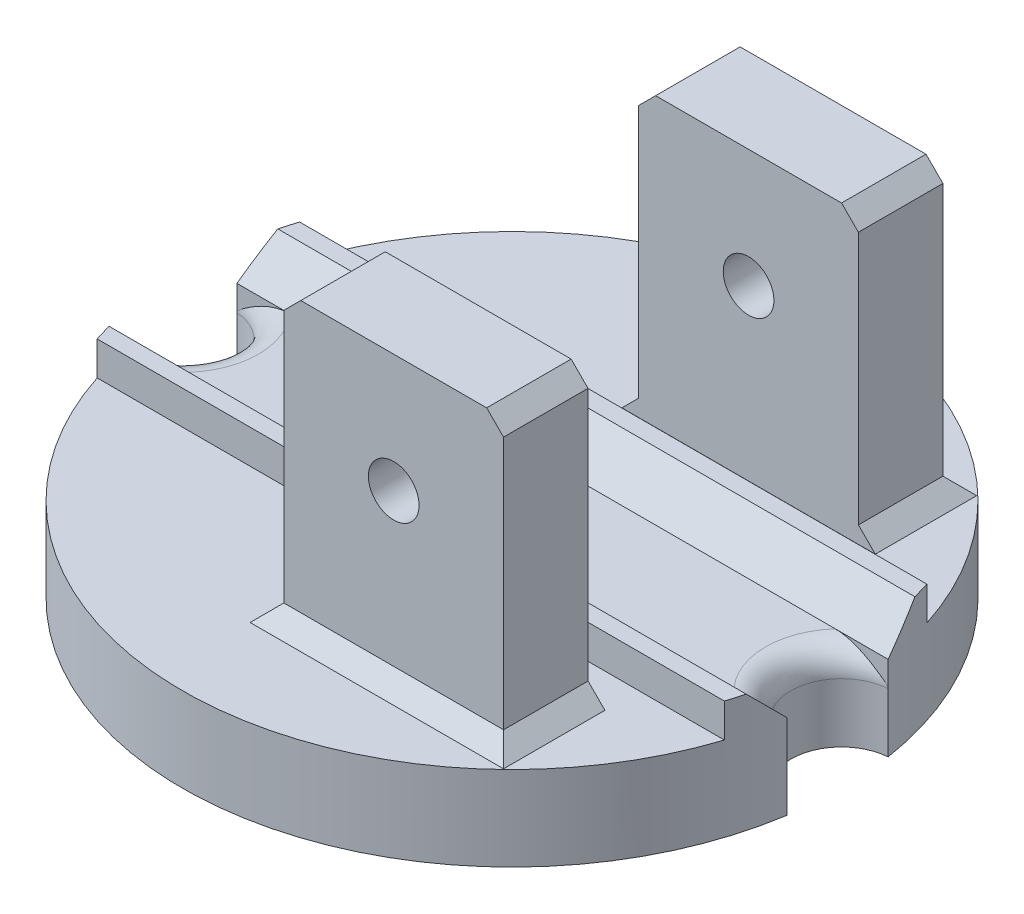
from build123d import *

# Parameters (mm, degrees)
PLATE_DEPTH         = 6.35
SKETCH2_W           = 16.51
SKETCH2_H           = 6.35
HOOK_UPRIGHTS_DEPTH = 21.59
SKETCH3_R           = 1.905
HOOK_BOLTHOLE_DEPTH = 56.526068149
BAND_GROOVE_DEPTH   = 2.54
FILLET4_R           = 1.905
CHAMFER1_SIZE       = 1.27
CHAMFER2_SIZE       = 2.54


with BuildPart() as part:
    # Sketch1 → plate (new body)
    with BuildSketch(Plane(origin=(0, 0, 0), x_dir=(1, 0, 0), z_dir=(0, 1, 0))):
        with BuildLine():
            ThreePointArc((-24.471923077, 3.798711086), (-20.955, 0), (-24.471923077, -3.798711086))
            ThreePointArc((-24.471923077, -3.798711086), (0, -24.765), (24.471923077, -3.798711086))
            ThreePointArc((24.471923077, -3.798711086), (20.955, 0), (24.471923077, 3.798711086))
            ThreePointArc((24.471923077, 3.798711086), (0, 24.765), (-24.471923077, 3.798711086))
        make_face()
    extrude(amount=PLATE_DEPTH)

    # Sketch2 → hook_uprights (add)
    with BuildSketch(Plane(origin=(0, 6.35, 0), x_dir=(1, 0, 0), z_dir=(0, 1, 0))):
        with Locations((7.62, 13.335)):
            Rectangle(SKETCH2_W, SKETCH2_H)
        with Locations((7.62, -13.335)):
            Rectangle(SKETCH2_W, SKETCH2_H)
    extrude(amount=HOOK_UPRIGHTS_DEPTH)

    # Sketch3 → hook_bolthole (cut, through all)
    with BuildSketch(Plane(origin=(0, 0, -16.51), x_dir=(-1, 0, 0), z_dir=(0, 0, -1))):
        with Locations((-7.62, 19.05)):
            Circle(SKETCH3_R)
    extrude(amount=-HOOK_BOLTHOLE_DEPTH, mode=Mode.SUBTRACT)

    # Sketch4 → band_groove (add)
    with BuildSketch(Plane(origin=(0, 6.35, 0), x_dir=(1, 0, 0), z_dir=(0, 1, 0))):
        with BuildLine():
            ThreePointArc((-23.567196282, 7.608711086), (-24.094984379, 5.721621518), (-24.471923077, 3.798711086))
            Line((-24.471923077, 3.798711086), (24.471923077, 3.798711086))
            ThreePointArc((24.471923077, 3.798711086), (24.094984379, 5.721621518), (23.567196282, 7.608711086))
            Line((23.567196282, 7.608711086), (-23.567196282, 7.608711086))
        make_face()
        with BuildLine():
            Line((-23.567196282, -7.608711086), (23.567196282, -7.608711086))
            ThreePointArc((23.567196282, -7.608711086), (24.094984379, -5.721621518), (24.471923077, -3.798711086))
            Line((24.471923077, -3.798711086), (-24.471923077, -3.798711086))
            ThreePointArc((-24.471923077, -3.798711086), (-24.094984379, -5.721621518), (-23.567196282, -7.608711086))
        make_face()
    extrude(amount=BAND_GROOVE_DEPTH)

    # Fillet4
    fillet4_edges = [part.edges().sort_by_distance(p)[0] for p in [
        (20.955, 6.35, 0),
        (-20.955, 6.35, 0),
    ]]
    fillet(fillet4_edges, radius=FILLET4_R)

    # Chamfer1
    chamfer1_edges = [part.edges().sort_by_distance(p)[0] for p in [
        (-0.635, 6.35, 13.335),
        (7.62, 6.35, 16.51),
        (15.875, 6.35, 13.335),
        (-0.635, 27.94, 13.335),
        (15.875, 27.94, 13.335),
        (-0.635, 6.35, -13.335),
        (15.875, 6.35, -13.335),
        (7.62, 6.35, -16.51),
        (-0.635, 27.94, -13.335),
        (15.875, 27.94, -13.335),
    ]]
    chamfer(chamfer1_edges, length=CHAMFER1_SIZE)

    # Chamfer2
    chamfer2_edges = [part.edges().sort_by_distance(p)[0] for p in [
        (0, 8.89, -3.798711086),
        (0, 8.89, 3.798711086),
    ]]
    chamfer(chamfer2_edges, length=CHAMFER2_SIZE - 0.0001)  # a hair under: the kernel refuses the full size


solid = part.part
